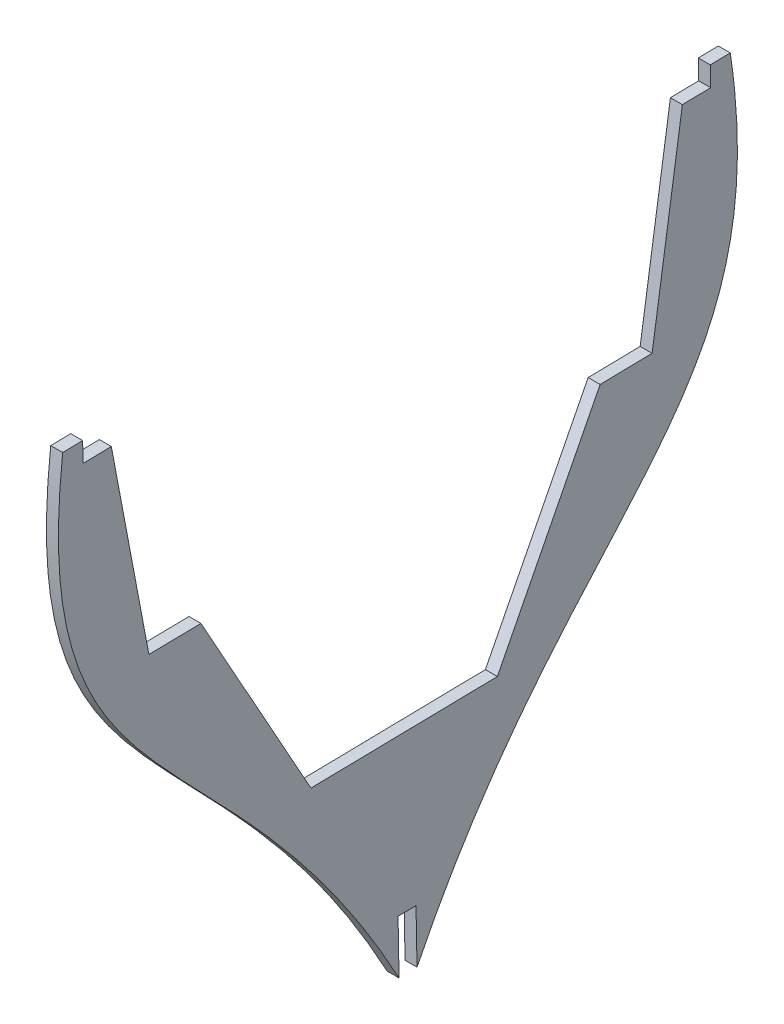
from build123d import *

# Parameters (mm, degrees)
BOSS_EXTRU_3_DEPTH      = 6
ENL_V_MAT_EXTRU_1_DEPTH = 6


with BuildPart() as part:
    # Esquisse2 → Boss.-Extru.3 (new body)
    with BuildSketch(Plane(origin=(0, 0, 0), x_dir=(0, 0, -1), z_dir=(1, 0, 0))):
        with BuildLine():
            Line((-173.669690696, 349.509558866), (-163.669690696, 349.693075024))
            Line((-163.669690696, 349.693075024), (-163.486174538, 339.693075024))
            Line((-163.486174538, 339.693075024), (-149.313037172, 339.953174995))
            Line((-149.313037172, 339.953174995), (-130.488226583, 240.281803014))
            Line((-130.488226583, 240.281803014), (-104.442234769, 240.759789049))
            Line((-104.442234769, 240.759789049), (-49.304516831, 141.754817592))
            Line((-49.304516831, 141.754817592), (44.070210021, 143.468394705))
            Line((44.070210021, 143.468394705), (95.538222692, 244.429753572))
            Line((95.538222692, 244.429753572), (121.584214506, 244.907739607))
            Line((121.584214506, 244.907739607), (136.739319827, 345.20269795))
            Line((136.739319827, 345.20269795), (150.912457193, 345.462797922))
            Line((150.912457193, 345.462797922), (150.728941035, 355.462797922))
            Line((150.728941035, 355.462797922), (160.728941035, 355.64631408))
            add(Edge.make_bspline(
                [(160.728941035, 355.64631408), (185.103993857, 193.931161453), (80.355290133, 200.09126163), (-0.522668597, 28.480794416)],
                knots=[0, 0, 0, 0, 1, 1, 1, 1], degree=3))
            add(Edge.make_bspline(
                [(-173.669690696, 349.509558866), (-192.094860481, 187.008952997), (-87.642707382, 197.008226924), (-0.522668597, 28.480794416)],
                knots=[0, 0, 0, 0, 1, 1, 1, 1], degree=3))
        make_face()
    extrude(amount=BOSS_EXTRU_3_DEPTH)

    # Esquisse3 → Enlèv. mat.-Extru.1 (cut)
    with BuildSketch(Plane(origin=(6, 0, 0), x_dir=(0, 0, -1), z_dir=(1, 0, 0))):
        Polygon((-5.186107903, 37.304202112), (-5.68160153, 64.304202112), (3.31839847, 64.469366654), (3.813892097, 37.469366654), (37.719885578, -5.632824455), (-29.18284778, -5.632824455), align=None)
    extrude(amount=-ENL_V_MAT_EXTRU_1_DEPTH, mode=Mode.SUBTRACT)


solid = part.part
